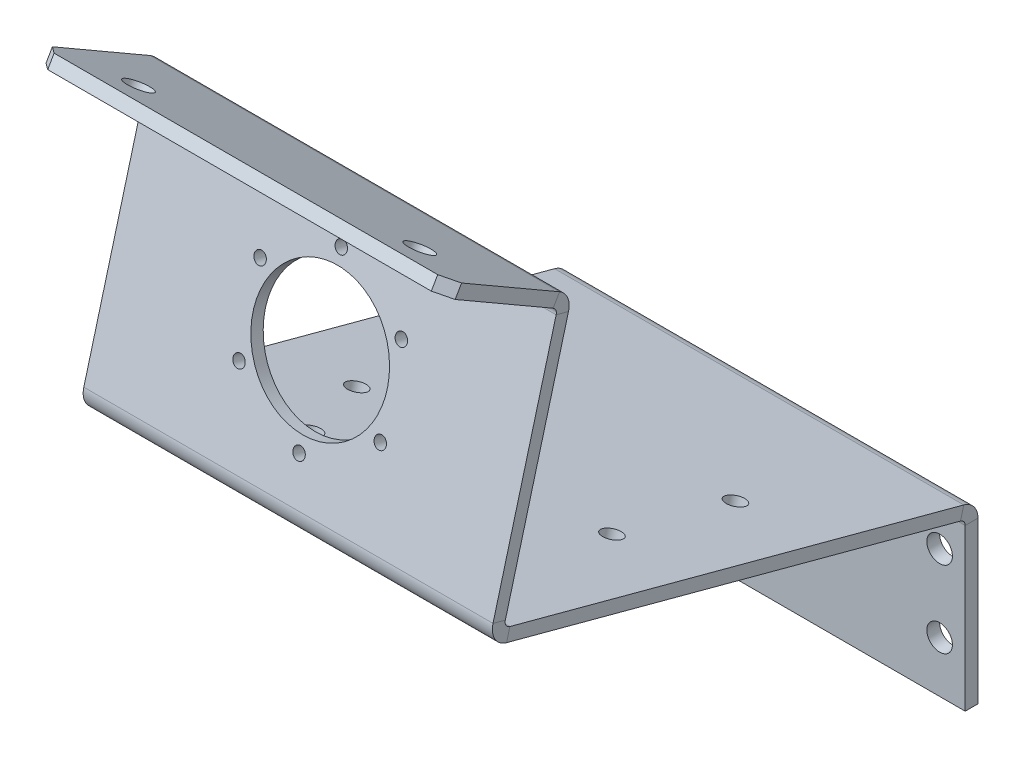
from build123d import *

# Parameters (mm, degrees)
SKETCH2_W                    = 203.2
SKETCH2_H                    = 88.9
BASE_FLANGE1_DEPTH           = 6.35
EDGE_FLANGE1_START           = -101.6
EDGE_FLANGE1_DEPTH           = 203.2
EDGE_FLANGE1_2_DEPTH         = 203.2
EDGE_FLANGE2_STRIP_W         = 31.75
EDGE_FLANGE2_STRIP_H         = 6.35
EDGE_FLANGE2_STRIP_CUT_DEPTH = 203.2
EDGE_FLANGE2_DEPTH           = 203.2
SKETCH13_R                   = 33.3375
SKETCH13_R_2                 = 3
CUT_EXTRUDE1_DEPTH           = 322.27645633
EDGE_FLANGE3_START           = -101.6
EDGE_FLANGE3_DEPTH           = 203.2
EDGE_FLANGE3_2_DEPTH         = 203.2
SKETCH17_R                   = 6.35
CUT_EXTRUDE2_DEPTH           = 373.253425916
SKETCH18_R                   = 4.7625
CUT_EXTRUDE3_DEPTH           = 370.310259163
BREAK_CORNER1_START          = -323.104570995
BREAK_CORNER1_OUTLINE_W      = 145.614442934
BREAK_CORNER1_OUTLINE_H      = 10
BREAK_CORNER1_DEPTH          = 4.490128061
BREAK_CORNER1_START_2        = -183.910601118
BREAK_CORNER1_2_OUTLINE_W    = 5.385557066
BREAK_CORNER1_2_OUTLINE_H    = 10
BREAK_CORNER1_2_DEPTH        = 8.980256121
SKETCH19_R                   = 6.35
CUT_EXTRUDE4_DEPTH           = 391.404403674
SKETCH20_R                   = 4.7625
CUT_EXTRUDE5_DEPTH           = 367.686034552


# Read off the part's stored shape, not the designer's step: Edge-Flange1, Edge-Flange3, Break-Corner1
# Sheet-metal steps are written as plain solids
with BuildPart() as part:
    # Sketch2 → Base-Flange1 (new body)
    with BuildSketch(Plane.XY):
        Rectangle(SKETCH2_W, SKETCH2_H)
    extrude(amount=-BASE_FLANGE1_DEPTH)

    # Edge-Flange1 outline → Edge-Flange1 (cut)
    with BuildSketch(Plane.YZ.offset(EDGE_FLANGE1_START)):
        with BuildLine():
            Line((44.45, 0), (44.419989189, 0))
            ThreePointArc((44.419989189, 0), (40.938994382, -4.602129933), (35.439733068, -6.35))
            Line((35.439733068, -6.35), (44.45, -6.35))
            Line((44.45, -6.35), (44.45, 0))
        make_face()
    extrude(amount=EDGE_FLANGE1_DEPTH, mode=Mode.SUBTRACT)

    # Edge-Flange1 2 outline → Edge-Flange1 2 (add)
    with BuildSketch(Plane.YZ.offset(EDGE_FLANGE1_START)):
        with BuildLine():
            ThreePointArc((44.419989189, 0), (44.537007132, 0.352726165), (44.640176563, 0.709748595))
            Line((44.640176563, 0.709748595), (107.504969662, 235.324350447))
            Line((107.504969662, 235.324350447), (101.371340665, 236.967851383))
            Line((101.371340665, 236.967851383), (38.506547566, 2.353249532))
            ThreePointArc((38.506547566, 2.353249532), (37.372550605, 0.656103145), (35.439733068, 0))
            Line((35.439733068, 0), (44.419989189, 0))
        make_face()
    extrude(amount=EDGE_FLANGE1_2_DEPTH)

    # Edge-Flange2 strip (across the edge) → Edge-Flange2 strip cut (cut)
    with BuildSketch(Plane(origin=(-101.6, 107.504969662, 235.324350447), x_dir=(0, -0.25881904510252135, -0.9659258262890682), z_dir=(1, 0, 0))):
        with Locations((-6.35, -3.175)):
            Rectangle(EDGE_FLANGE2_STRIP_W, EDGE_FLANGE2_STRIP_H)
    extrude(amount=EDGE_FLANGE2_STRIP_CUT_DEPTH, mode=Mode.SUBTRACT)

    # Edge-Flange2 section (across the edge) → Edge-Flange2 (add)
    with BuildSketch(Plane(origin=(-101.6, 107.504969662, 235.324350447), x_dir=(0, -0.25881904510252135, -0.9659258262890682), z_dir=(1, 0, 0))):
        with BuildLine():
            Line((0, 3.175), (0, 133.35))
            Line((0, 133.35), (6.35, 133.35))
            Line((6.35, 133.35), (6.35, 3.175))
            ThreePointArc((6.35, 3.175), (7.27993597, 0.92993597), (9.525, 0))
            Line((9.525, 0), (9.525, -6.35))
            ThreePointArc((9.525, -6.35), (2.789807909, -3.560192091), (0, 3.175))
        make_face()
    extrude(amount=EDGE_FLANGE2_DEPTH)

    # Sketch13 → Cut-Extrude1 (cut, through all)
    with BuildSketch(Plane(origin=(0, 66.032555063, 246.436850447), x_dir=(1, 0, 0), z_dir=(0, 0.25881904510252135, 0.9659258262890682))):
        with Locations(Location((0, 107.070402979, 0), (0, 0, 270))):
            Circle(SKETCH13_R)
        with Locations(Location((35.074028853, 86.820402979, 0), (0, 0, 270))):
            Circle(SKETCH13_R_2)
        with Locations(Location((0, 66.570402979, 0), (0, 0, 270))):
            Circle(SKETCH13_R_2)
        with Locations(Location((-35.074028853, 86.820402979, 0), (0, 0, 270))):
            Circle(SKETCH13_R_2)
        with Locations(Location((-35.074028853, 127.320402979, 0), (0, 0, 270))):
            Circle(SKETCH13_R_2)
        with Locations(Location((35.074028853, 127.320402979, 0), (0, 0, 270))):
            Circle(SKETCH13_R_2)
        with Locations(Location((0, 147.570402979, 0), (0, 0, 270))):
            Circle(SKETCH13_R_2)
    extrude(amount=-CUT_EXTRUDE1_DEPTH, mode=Mode.SUBTRACT)

    # Edge-Flange3 outline → Edge-Flange3 (cut)
    with BuildSketch(Plane.YZ.offset(EDGE_FLANGE3_START)):
        with BuildLine():
            Line((236.311178597, 200.810830783), (236.28219038, 200.818598152))
            ThreePointArc((236.28219038, 200.818598152), (231.72868872, 197.274229745), (225.964428129, 197.009230469))
            Line((225.964428129, 197.009230469), (234.667677661, 194.677201786))
            Line((234.667677661, 194.677201786), (236.311178597, 200.810830783))
        make_face()
    extrude(amount=EDGE_FLANGE3_DEPTH, mode=Mode.SUBTRACT)

    # Edge-Flange3 2 outline → Edge-Flange3 2 (add)
    with BuildSketch(Plane.YZ.offset(EDGE_FLANGE3_START)):
        with BuildLine():
            ThreePointArc((236.28219038, 200.818598152), (236.486513283, 201.129018993), (236.678571505, 201.447173965))
            Line((236.678571505, 201.447173965), (267.949176724, 255.609450989))
            Line((267.949176724, 255.609450989), (262.44991541, 258.784450989))
            Line((262.44991541, 258.784450989), (231.179310191, 204.622173965))
            ThreePointArc((231.179310191, 204.622173965), (229.644699431, 203.276356449), (227.607929065, 203.142859466))
            Line((227.607929065, 203.142859466), (236.28219038, 200.818598152))
        make_face()
    extrude(amount=EDGE_FLANGE3_2_DEPTH)

    # Sketch17 → Cut-Extrude2 (cut, through all)
    with BuildSketch(Plane(origin=(0, 84.780482228, -48.948034236), x_dir=(1, 0, 0), z_dir=(0, -0.8660254037844363, 0.5000000000000042))):
        with Locations(Location((-69.85, 336.288866366, 0), (0, 0, 270))):
            Circle(SKETCH17_R)
        with Locations(Location((69.85, 336.288866366, 0), (0, 0, 270))):
            Circle(SKETCH17_R)
    extrude(amount=-CUT_EXTRUDE2_DEPTH, mode=Mode.SUBTRACT)

    # Sketch18 → Cut-Extrude3 (cut, through all)
    with BuildSketch(Plane(origin=(0, 35.338785602, -9.468999064), x_dir=(1, 0, 0), z_dir=(0, -0.9659258262890673, 0.2588190451025248))):
        with Locations(Location((-44.45, 196.339070344, 0), (0, 0, 270))):
            Circle(SKETCH18_R)
        with Locations(Location((44.45, 196.339070344, 0), (0, 0, 270))):
            Circle(SKETCH18_R)
    extrude(amount=-CUT_EXTRUDE3_DEPTH, mode=Mode.SUBTRACT)

    # Break-Corner1 outline → Break-Corner1 (cut)
    with BuildSketch(Plane(origin=(0, 0, 0), x_dir=(0.7071067811865475, 0.35355339059327684, 0.6123724356957928), z_dir=(0.7071067811865476, -0.3535533905932768, -0.6123724356957927)).offset(BREAK_CORNER1_START)):
        with Locations((245.807221467, -101)):
            Rectangle(BREAK_CORNER1_OUTLINE_W, BREAK_CORNER1_OUTLINE_H)
    extrude(amount=BREAK_CORNER1_DEPTH, mode=Mode.SUBTRACT)

    # Break-Corner1 2 outline → Break-Corner1 2 (cut)
    with BuildSketch(Plane(origin=(0, 0, 0), x_dir=(0.7071067811865475, 0.35355339059327684, 0.6123724356957928), z_dir=(0.7071067811865476, -0.3535533905932768, -0.6123724356957927)).offset(BREAK_CORNER1_START_2)):
        with Locations((321.307221467, -101)):
            Rectangle(BREAK_CORNER1_2_OUTLINE_W, BREAK_CORNER1_2_OUTLINE_H)
    extrude(amount=BREAK_CORNER1_2_DEPTH, mode=Mode.SUBTRACT)

    # Sketch19 → Cut-Extrude4 (cut, through all)
    with BuildSketch(Plane(origin=(0, 0, -6.35), x_dir=(-1, 0, 0), z_dir=(0, 0, -1))):
        with Locations((-88.9, 19.05)):
            Circle(SKETCH19_R)
        with Locations((-88.9, -19.05)):
            Circle(SKETCH19_R)
        with Locations((88.9, -19.05)):
            Circle(SKETCH19_R)
        with Locations((88.9, 19.05)):
            Circle(SKETCH19_R)
    extrude(amount=-CUT_EXTRUDE4_DEPTH, mode=Mode.SUBTRACT)

    # Sketch20 → Cut-Extrude5 (cut, through all)
    with BuildSketch(Plane(origin=(0, 41.472414599, -11.1125), x_dir=(1, 0, 0), z_dir=(0, 0.9659258262890673, -0.2588190451025248))):
        with Locations(Location((63.364615818, -153.530201243, 0), (0, 0, 270))):
            Circle(SKETCH20_R)
        with Locations(Location((63.364615818, -90.030201243, 0), (0, 0, 270))):
            Circle(SKETCH20_R)
        with Locations(Location((-63.364615818, -90.030201243, 0), (0, 0, 270))):
            Circle(SKETCH20_R)
        with Locations(Location((-63.364615818, -153.530201243, 0), (0, 0, 270))):
            Circle(SKETCH20_R)
    extrude(amount=-CUT_EXTRUDE5_DEPTH, mode=Mode.SUBTRACT)


solid = part.part
